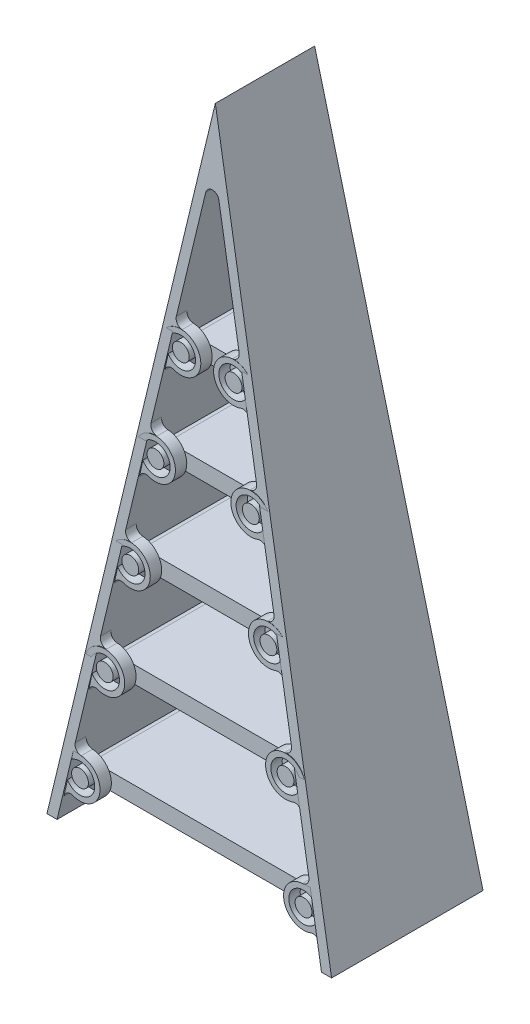
from build123d import *
from build123d.topology import SkipClean

# Parameters (mm, degrees)
AUFSATZ_LINEAR_AUSTRAGEN4_DEPTH      = 18
SCHNITT_LINEAR_AUSTRAGEN1_DEPTH      = 89.73537072
AUFSATZ_LINEAR_AUSTRAGEN5_DEPTH      = 5.37
AUFSATZ_LINEAR_AUSTRAGEN5_DEPTH_BACK = 5.37
AUFSATZ_LINEAR_AUSTRAGEN6_DEPTH      = 5.85
AUFSATZ_LINEAR_AUSTRAGEN6_DEPTH_BACK = 5.85
AUFSATZ_LINEAR_AUSTRAGEN7_DEPTH      = 6.3
AUFSATZ_LINEAR_AUSTRAGEN7_DEPTH_BACK = 6.3
AUFSATZ_LINEAR_AUSTRAGEN8_DEPTH      = 6.8
AUFSATZ_LINEAR_AUSTRAGEN8_DEPTH_BACK = 6.8
AUFSATZ_LINEAR_AUSTRAGEN9_DEPTH      = 7.2
AUFSATZ_LINEAR_AUSTRAGEN9_DEPTH_BACK = 7.2
SKIZZE13_R                           = 1
AUFSATZ_LINEAR_AUSTRAGEN12_DEPTH     = 1.5
SKIZZE14_R                           = 1
AUFSATZ_LINEAR_AUSTRAGEN13_DEPTH     = 1.5
SKIZZE15_R                           = 1
AUFSATZ_LINEAR_AUSTRAGEN14_DEPTH     = 1.5
SKIZZE16_R                           = 1
AUFSATZ_LINEAR_AUSTRAGEN15_DEPTH     = 1.5
SKIZZE17_R                           = 1
AUFSATZ_LINEAR_AUSTRAGEN16_DEPTH     = 1.5
SKIZZE18_R                           = 1
AUFSATZ_LINEAR_AUSTRAGEN17_DEPTH     = 1.5
SKIZZE19_R                           = 1
AUFSATZ_LINEAR_AUSTRAGEN18_DEPTH     = 1.5
SKIZZE20_R                           = 1
AUFSATZ_LINEAR_AUSTRAGEN19_DEPTH     = 1.5
SKIZZE21_R                           = 1
AUFSATZ_LINEAR_AUSTRAGEN20_DEPTH     = 1.5
SKIZZE22_R                           = 1
AUFSATZ_LINEAR_AUSTRAGEN21_DEPTH     = 1.5
SKIZZE24_R                           = 2.375
SKIZZE24_R_2                         = 1.75
AUFSATZ_LINEAR_AUSTRAGEN22_DEPTH     = 1.35
SKIZZE25_R                           = 2.375
SKIZZE25_R_2                         = 1.75
AUFSATZ_LINEAR_AUSTRAGEN23_DEPTH     = 1.35
SKIZZE26_R                           = 2.375
SKIZZE26_R_2                         = 1.75
AUFSATZ_LINEAR_AUSTRAGEN24_DEPTH     = 1.35
SKIZZE27_R                           = 2.375
SKIZZE27_R_2                         = 1.75
AUFSATZ_LINEAR_AUSTRAGEN25_DEPTH     = 1.35
SKIZZE28_R                           = 2.375
SKIZZE28_R_2                         = 1.75
AUFSATZ_LINEAR_AUSTRAGEN26_DEPTH     = 1.35
AUFSATZ_LINEAR_START                 = -1.35
SKIZZE29_R                           = 2.375
SKIZZE29_R_2                         = 1.75
AUFSATZ_LINEAR_AUSTRAGEN27_DEPTH     = 1.35
SKIZZE30_R                           = 2.375
SKIZZE30_R_2                         = 1.75
AUFSATZ_LINEAR_AUSTRAGEN28_DEPTH     = 1.35
SKIZZE31_R                           = 2.375
SKIZZE31_R_2                         = 1.75
AUFSATZ_LINEAR_AUSTRAGEN29_DEPTH     = 1.35
SKIZZE32_R                           = 2.375
SKIZZE32_R_2                         = 1.75
AUFSATZ_LINEAR_AUSTRAGEN30_DEPTH     = 1.35
SKIZZE33_R                           = 2.375
SKIZZE33_R_2                         = 1.75
AUFSATZ_LINEAR_AUSTRAGEN31_DEPTH     = 1.35
VERRUNDUNG1_R                        = 0.8
VERRUNDUNG2_R                        = 0.8


with BuildPart() as part:
    # Skizze1 → Aufsatz-Linear austragen4 (new body)
    with BuildSketch(Plane.XY):
        Polygon((0, 0), (16.911148858, -80), (15.711148858, -80), (0, -5.676728459), (-15.711148858, -80), (-16.911148858, -80), align=None)
    extrude(amount=AUFSATZ_LINEAR_AUSTRAGEN4_DEPTH)

    # Skizze11 → Schnitt-Linear austragen1 (cut, through all)
    with BuildSketch(Plane(origin=(17, 0, 0), x_dir=(0, 0, -1), z_dir=(1, 0, 0))):
        Polygon((-18, -80), (-14.9, 0), (-18, 0), align=None)
        Polygon((0, -80), (-3.1, 0), (0, 0), align=None)
    extrude(amount=-SCHNITT_LINEAR_AUSTRAGEN1_DEPTH, mode=Mode.SUBTRACT)

    # Skizze24 → Aufsatz-Linear austragen22 (add)
    # profile 1 of 2: a face of its own
    with BuildSketch(Plane.XY.offset(15.87)):
        with Locations((-3.132547008, -26.676728459)):
            Circle(SKIZZE24_R)
        with Locations((-3.132547008, -26.676728459)):
            Circle(SKIZZE24_R_2, mode=Mode.SUBTRACT)
    # profile 2 of 2: a face of its own
    with BuildSketch(Plane.XY.offset(15.87)):
        with Locations((3.132547008, -26.676728459)):
            Circle(SKIZZE24_R)
        with Locations((3.132547008, -26.676728459)):
            Circle(SKIZZE24_R_2, mode=Mode.SUBTRACT)
    extrude(amount=-AUFSATZ_LINEAR_AUSTRAGEN22_DEPTH)

    # Skizze25 → Aufsatz-Linear austragen23 (add)
    # profile 1 of 2: a face of its own
    with BuildSketch(Plane.XY.offset(16.35)):
        with Locations((-5.669219336, -38.676728459)):
            Circle(SKIZZE25_R)
        with Locations((-5.669219336, -38.676728459)):
            Circle(SKIZZE25_R_2, mode=Mode.SUBTRACT)
    # profile 2 of 2: a face of its own
    with BuildSketch(Plane.XY.offset(16.35)):
        with Locations((5.669219336, -38.676728459)):
            Circle(SKIZZE25_R)
        with Locations((5.669219336, -38.676728459)):
            Circle(SKIZZE25_R_2, mode=Mode.SUBTRACT)
    extrude(amount=-AUFSATZ_LINEAR_AUSTRAGEN23_DEPTH)

    # Skizze26 → Aufsatz-Linear austragen24 (add)
    # profile 1 of 2: a face of its own
    with BuildSketch(Plane.XY.offset(16.8)):
        with Locations((-8.205891665, -50.676728459)):
            Circle(SKIZZE26_R)
        with Locations((-8.205891665, -50.676728459)):
            Circle(SKIZZE26_R_2, mode=Mode.SUBTRACT)
    # profile 2 of 2: a face of its own
    with BuildSketch(Plane.XY.offset(16.8)):
        with Locations((8.205891665, -50.676728459)):
            Circle(SKIZZE26_R)
        with Locations((8.205891665, -50.676728459)):
            Circle(SKIZZE26_R_2, mode=Mode.SUBTRACT)
    extrude(amount=-AUFSATZ_LINEAR_AUSTRAGEN24_DEPTH)

    # Skizze27 → Aufsatz-Linear austragen25 (add)
    # profile 1 of 2: a face of its own
    with BuildSketch(Plane.XY.offset(17.3)):
        with Locations((-10.742563994, -62.676728459)):
            Circle(SKIZZE27_R)
        with Locations((-10.742563994, -62.676728459)):
            Circle(SKIZZE27_R_2, mode=Mode.SUBTRACT)
    # profile 2 of 2: a face of its own
    with BuildSketch(Plane.XY.offset(17.3)):
        with Locations((10.742563994, -62.676728459)):
            Circle(SKIZZE27_R)
        with Locations((10.742563994, -62.676728459)):
            Circle(SKIZZE27_R_2, mode=Mode.SUBTRACT)
    extrude(amount=-AUFSATZ_LINEAR_AUSTRAGEN25_DEPTH)

    # Skizze28 → Aufsatz-Linear austragen26 (add)
    # profile 1 of 2: a face of its own
    with BuildSketch(Plane.XY.offset(17.7)):
        with Locations((-13.279236322, -74.676728459)):
            Circle(SKIZZE28_R)
        with Locations((-13.279236322, -74.676728459)):
            Circle(SKIZZE28_R_2, mode=Mode.SUBTRACT)
    # profile 2 of 2: a face of its own
    with BuildSketch(Plane.XY.offset(17.7)):
        with Locations((13.279236322, -74.676728459)):
            Circle(SKIZZE28_R)
        with Locations((13.279236322, -74.676728459)):
            Circle(SKIZZE28_R_2, mode=Mode.SUBTRACT)
    extrude(amount=-AUFSATZ_LINEAR_AUSTRAGEN26_DEPTH)

    # Skizze29 → Aufsatz-Linear austragen27 (add)
    # profile 1 of 2: a face of its own
    with BuildSketch(Plane(origin=(0, 0, 2.13), x_dir=(-1, 0, 0), z_dir=(0, 0, -1)).offset(AUFSATZ_LINEAR_START)):
        with Locations((-3.132547008, -26.676728459)):
            Circle(SKIZZE29_R)
        with Locations((-3.132547008, -26.676728459)):
            Circle(SKIZZE29_R_2, mode=Mode.SUBTRACT)
    # profile 2 of 2: a face of its own
    with BuildSketch(Plane(origin=(0, 0, 2.13), x_dir=(-1, 0, 0), z_dir=(0, 0, -1)).offset(AUFSATZ_LINEAR_START)):
        with Locations((3.132547008, -26.676728459)):
            Circle(SKIZZE29_R)
        with Locations((3.132547008, -26.676728459)):
            Circle(SKIZZE29_R_2, mode=Mode.SUBTRACT)
    extrude(amount=AUFSATZ_LINEAR_AUSTRAGEN27_DEPTH)

    # Skizze30 → Aufsatz-Linear austragen28 (add)
    # profile 1 of 2: a face of its own
    with BuildSketch(Plane(origin=(0, 0, 1.65), x_dir=(-1, 0, 0), z_dir=(0, 0, -1)).offset(AUFSATZ_LINEAR_START)):
        with Locations((-5.669219336, -38.676728459)):
            Circle(SKIZZE30_R)
        with Locations((-5.669219336, -38.676728459)):
            Circle(SKIZZE30_R_2, mode=Mode.SUBTRACT)
    # profile 2 of 2: a face of its own
    with BuildSketch(Plane(origin=(0, 0, 1.65), x_dir=(-1, 0, 0), z_dir=(0, 0, -1)).offset(AUFSATZ_LINEAR_START)):
        with Locations((5.669219336, -38.676728459)):
            Circle(SKIZZE30_R)
        with Locations((5.669219336, -38.676728459)):
            Circle(SKIZZE30_R_2, mode=Mode.SUBTRACT)
    extrude(amount=AUFSATZ_LINEAR_AUSTRAGEN28_DEPTH)

    # Skizze31 → Aufsatz-Linear austragen29 (add)
    # profile 1 of 2: a face of its own
    with BuildSketch(Plane(origin=(0, 0, 1.2), x_dir=(-1, 0, 0), z_dir=(0, 0, -1)).offset(AUFSATZ_LINEAR_START)):
        with Locations((-8.205891665, -50.676728459)):
            Circle(SKIZZE31_R)
        with Locations((-8.205891665, -50.676728459)):
            Circle(SKIZZE31_R_2, mode=Mode.SUBTRACT)
    # profile 2 of 2: a face of its own
    with BuildSketch(Plane(origin=(0, 0, 1.2), x_dir=(-1, 0, 0), z_dir=(0, 0, -1)).offset(AUFSATZ_LINEAR_START)):
        with Locations((8.205891665, -50.676728459)):
            Circle(SKIZZE31_R)
        with Locations((8.205891665, -50.676728459)):
            Circle(SKIZZE31_R_2, mode=Mode.SUBTRACT)
    extrude(amount=AUFSATZ_LINEAR_AUSTRAGEN29_DEPTH)

    # Skizze32 → Aufsatz-Linear austragen30 (add)
    # profile 1 of 2: a face of its own
    with BuildSketch(Plane(origin=(0, 0, 0.7), x_dir=(-1, 0, 0), z_dir=(0, 0, -1)).offset(AUFSATZ_LINEAR_START)):
        with Locations((-10.742563994, -62.676728459)):
            Circle(SKIZZE32_R)
        with Locations((-10.742563994, -62.676728459)):
            Circle(SKIZZE32_R_2, mode=Mode.SUBTRACT)
    # profile 2 of 2: a face of its own
    with BuildSketch(Plane(origin=(0, 0, 0.7), x_dir=(-1, 0, 0), z_dir=(0, 0, -1)).offset(AUFSATZ_LINEAR_START)):
        with Locations((10.742563994, -62.676728459)):
            Circle(SKIZZE32_R)
        with Locations((10.742563994, -62.676728459)):
            Circle(SKIZZE32_R_2, mode=Mode.SUBTRACT)
    extrude(amount=AUFSATZ_LINEAR_AUSTRAGEN30_DEPTH)

    # Skizze33 → Aufsatz-Linear austragen31 (add)
    # profile 1 of 2: a face of its own
    with BuildSketch(Plane(origin=(0, 0, 0.3), x_dir=(-1, 0, 0), z_dir=(0, 0, -1)).offset(AUFSATZ_LINEAR_START)):
        with Locations((-13.279236322, -74.676728459)):
            Circle(SKIZZE33_R)
        with Locations((-13.279236322, -74.676728459)):
            Circle(SKIZZE33_R_2, mode=Mode.SUBTRACT)
    # profile 2 of 2: a face of its own
    with BuildSketch(Plane(origin=(0, 0, 0.3), x_dir=(-1, 0, 0), z_dir=(0, 0, -1)).offset(AUFSATZ_LINEAR_START)):
        with Locations((13.279236322, -74.676728459)):
            Circle(SKIZZE33_R)
        with Locations((13.279236322, -74.676728459)):
            Circle(SKIZZE33_R_2, mode=Mode.SUBTRACT)
    extrude(amount=AUFSATZ_LINEAR_AUSTRAGEN31_DEPTH)

    # Verrundung1
    verrundung1_edges = [part.edges().sort_by_distance(p)[0] for p in [
        (0, -5.676728459, 9),
    ]]
    fillet(verrundung1_edges, radius=VERRUNDUNG1_R)

    # Verrundung2
    # the kernel refuses this fillet: 0.8 mm, written as the material it adds along each edge
    with BuildSketch(Plane(origin=(-7.333926251, -40.370651683, 15), x_dir=(-0.20681895998091412, -0.9783792300495822, 0), z_dir=(0, 0, 1)), Plane(origin=(-9.87059858, -52.370651683, 15.45), x_dir=(-0.20681895998091412, -0.9783792300495822, 0), z_dir=(0, 0, 1)), Plane(origin=(-12.407270908, -64.370651683, 15.95), x_dir=(-0.2068189599809156, -0.9783792300495817, 0), z_dir=(0, 0, 1)), Plane(origin=(-14.943943237, -76.370651683, 16.35), x_dir=(-0.2068189599809131, -0.9783792300495824, 0), z_dir=(0, 0, 1)), Plane(origin=(-4.797253922, -28.370651683, 2.13), x_dir=(-0.20681895998091113, -0.9783792300495827, 0), z_dir=(0, 0, 1)), Plane(origin=(-7.333926251, -40.370651683, 1.65), x_dir=(-0.2068189599809139, -0.9783792300495822, 0), z_dir=(0, 0, 1)), Plane(origin=(-9.87059858, -52.370651683, 1.2), x_dir=(-0.20681895998091412, -0.9783792300495822, 0), z_dir=(0, 0, 1)), Plane(origin=(-12.407270908, -64.370651683, 0.7), x_dir=(-0.20681895998091412, -0.9783792300495822, 0), z_dir=(0, 0, 1)), Plane(origin=(-14.943943237, -76.370651683, 0.3), x_dir=(-0.2068189599809131, -0.9783792300495824, 0), z_dir=(0, 0, 1)), Plane(origin=(-4.797253922, -28.370651683, 14.52), x_dir=(-0.20681895998091177, -0.9783792300495826, 0), z_dir=(0, 0, 1))) as verrundung2_piece_1:
        with BuildLine():
            CenterArc((1.137162009, 0.8), VERRUNDUNG2_R, 171.334207831, 98.665792169)
            ThreePointArc((0.346294794, 0.920536499), (0.221320117, 0.44214625), (0, 0))
            Line((0, 0), (1.137162009, 0))
        make_face()
    extrude(amount=1.35)
    with BuildSketch(Plane(origin=(-6.505991795, -36.45401911, 15), x_dir=(0.20681895998091263, 0.9783792300495825, 0), z_dir=(0, 0, 1))) as verrundung2_piece_2_section:
        with BuildLine():
            CenterArc((1.137162009, -0.8), VERRUNDUNG2_R, 90, 98.665792169)
            ThreePointArc((0.346294794, -0.920536499), (0.221320117, -0.44214625), (0, 0))
            Line((0, 0), (1.137162009, 0))
        make_face()
    verrundung2_piece_2 = extrude(amount=4.155498263, mode=Mode.PRIVATE)
    verrundung2_piece_2 = split(verrundung2_piece_2, bisect_by=Plane(origin=(-6.217215771, -36.095589606, 16.298704097), z_dir=(0, -0.03872093994908253, -0.9992500632021294)), keep=Keep.TOP, mode=Mode.PRIVATE)
    add(verrundung2_piece_2)
    with BuildSketch(Plane(origin=(7.333926251, -40.370651683, 15), x_dir=(0.20681895998091462, -0.9783792300495819, 0), z_dir=(0, 0, 1)), Plane(origin=(9.87059858, -52.370651683, 15.45), x_dir=(0.20681895998091263, -0.9783792300495825, 0), z_dir=(0, 0, 1)), Plane(origin=(12.407270908, -64.370651683, 15.95), x_dir=(0.20681895998091412, -0.9783792300495822, 0), z_dir=(0, 0, 1)), Plane(origin=(14.943943237, -76.370651683, 16.35), x_dir=(0.20681895998090907, -0.9783792300495833, 0), z_dir=(0, 0, 1)), Plane(origin=(4.797253922, -28.370651683, 2.13), x_dir=(0.20681895998091462, -0.9783792300495819, 0), z_dir=(0, 0, 1)), Plane(origin=(7.333926251, -40.370651683, 1.65), x_dir=(0.20681895998091462, -0.9783792300495819, 0), z_dir=(0, 0, 1)), Plane(origin=(9.87059858, -52.370651683, 1.2), x_dir=(0.20681895998091412, -0.9783792300495822, 0), z_dir=(0, 0, 1)), Plane(origin=(12.407270908, -64.370651683, 0.7), x_dir=(0.20681895998091412, -0.9783792300495822, 0), z_dir=(0, 0, 1)), Plane(origin=(14.943943237, -76.370651683, 0.3), x_dir=(0.20681895998091113, -0.9783792300495827, 0), z_dir=(0, 0, 1)), Plane(origin=(4.797253922, -28.370651683, 14.52), x_dir=(0.20681895998091462, -0.9783792300495819, 0), z_dir=(0, 0, 1))) as verrundung2_piece_3:
        with BuildLine():
            CenterArc((1.137162009, -0.8), VERRUNDUNG2_R, 90, 98.665792169)
            ThreePointArc((0.346294794, -0.920536499), (0.221320117, -0.44214625), (0, 0))
            Line((0, 0), (1.137162009, 0))
        make_face()
    extrude(amount=1.35)
    with BuildSketch(Plane(origin=(6.505991795, -36.45401911, 15), x_dir=(-0.20681895998091487, 0.9783792300495819, 0), z_dir=(0, 0, 1))) as verrundung2_piece_4_section:
        with BuildLine():
            CenterArc((1.137162009, 0.8), VERRUNDUNG2_R, 171.334207831, 98.665792169)
            ThreePointArc((0.346294794, 0.920536499), (0.221320117, 0.44214625), (0, 0))
            Line((0, 0), (1.137162009, 0))
        make_face()
    verrundung2_piece_4 = extrude(amount=4.155498263, mode=Mode.PRIVATE)
    verrundung2_piece_4 = split(verrundung2_piece_4, bisect_by=Plane(origin=(6.217215771, -36.095589606, 16.298704097), z_dir=(0, -0.03872093994908253, -0.9992500632021294)), keep=Keep.TOP, mode=Mode.PRIVATE)
    add(verrundung2_piece_4)
    with BuildSketch(Plane(origin=(-9.042664124, -48.45401911, 15.45), x_dir=(0.20681895998091288, 0.9783792300495825, 0), z_dir=(0, 0, 1))) as verrundung2_piece_5_section:
        with BuildLine():
            CenterArc((1.137162009, -0.8), VERRUNDUNG2_R, 90, 98.665792169)
            ThreePointArc((0.346294794, -0.920536499), (0.221320117, -0.44214625), (0, 0))
            Line((0, 0), (1.137162009, 0))
        make_face()
    verrundung2_piece_5 = extrude(amount=4.170498263, mode=Mode.PRIVATE)
    verrundung2_piece_5 = split(verrundung2_piece_5, bisect_by=Plane(origin=(-8.753891259, -48.095283689, 16.763692243), z_dir=(0, -0.03872093994908253, -0.9992500632021294)), keep=Keep.TOP, mode=Mode.PRIVATE)
    add(verrundung2_piece_5)
    with BuildSketch(Plane(origin=(9.042664124, -48.45401911, 15.45), x_dir=(-0.2068189599809156, 0.9783792300495817, 0), z_dir=(0, 0, 1))) as verrundung2_piece_6_section:
        with BuildLine():
            CenterArc((1.137162009, 0.8), VERRUNDUNG2_R, 171.334207831, 98.665792169)
            ThreePointArc((0.346294794, 0.920536499), (0.221320117, 0.44214625), (0, 0))
            Line((0, 0), (1.137162009, 0))
        make_face()
    verrundung2_piece_6 = extrude(amount=4.170498263, mode=Mode.PRIVATE)
    verrundung2_piece_6 = split(verrundung2_piece_6, bisect_by=Plane(origin=(8.753891259, -48.095283689, 16.763692243), z_dir=(0, -0.03872093994908253, -0.9992500632021294)), keep=Keep.TOP, mode=Mode.PRIVATE)
    add(verrundung2_piece_6)
    with BuildSketch(Plane(origin=(-11.579336453, -60.45401911, 15.95), x_dir=(0.2068189599809101, 0.9783792300495829, 0), z_dir=(0, 0, 1))) as verrundung2_piece_7_section:
        with BuildLine():
            CenterArc((1.137162009, -0.8), VERRUNDUNG2_R, 90, 98.665792169)
            ThreePointArc((0.346294794, -0.920536499), (0.221320117, -0.44214625), (0, 0))
            Line((0, 0), (1.137162009, 0))
        make_face()
    verrundung2_piece_7 = extrude(amount=4.135498263, mode=Mode.PRIVATE)
    verrundung2_piece_7 = split(verrundung2_piece_7, bisect_by=Plane(origin=(-11.290556099, -60.095998069, 17.228719925), z_dir=(0, -0.03872093994908253, -0.9992500632021294)), keep=Keep.TOP, mode=Mode.PRIVATE)
    add(verrundung2_piece_7)
    with BuildSketch(Plane(origin=(11.579336453, -60.45401911, 15.95), x_dir=(-0.20681895998091435, 0.978379230049582, 0), z_dir=(0, 0, 1))) as verrundung2_piece_8_section:
        with BuildLine():
            CenterArc((1.137162009, 0.8), VERRUNDUNG2_R, 171.334207831, 98.665792169)
            ThreePointArc((0.346294794, 0.920536499), (0.221320117, 0.44214625), (0, 0))
            Line((0, 0), (1.137162009, 0))
        make_face()
    verrundung2_piece_8 = extrude(amount=4.135498263, mode=Mode.PRIVATE)
    verrundung2_piece_8 = split(verrundung2_piece_8, bisect_by=Plane(origin=(11.290556099, -60.095998069, 17.228719925), z_dir=(0, -0.03872093994908253, -0.9992500632021294)), keep=Keep.TOP, mode=Mode.PRIVATE)
    add(verrundung2_piece_8)
    with BuildSketch(Plane(origin=(-14.116008781, -72.45401911, 16.35), x_dir=(0.20681895998091412, 0.9783792300495822, 0), z_dir=(0, 0, 1))) as verrundung2_piece_9_section:
        with BuildLine():
            CenterArc((1.137162009, -0.8), VERRUNDUNG2_R, 90, 98.665792169)
            ThreePointArc((0.346294794, -0.920536499), (0.221320117, -0.44214625), (0, 0))
            Line((0, 0), (1.137162009, 0))
        make_face()
    verrundung2_piece_9 = extrude(amount=1.35, mode=Mode.PRIVATE)
    verrundung2_piece_9 = split(verrundung2_piece_9, bisect_by=Plane(origin=(-13.827218085, -72.094512866, 17.693662374), z_dir=(0, -0.03872093994908253, -0.9992500632021294)), keep=Keep.TOP, mode=Mode.PRIVATE)
    add(verrundung2_piece_9)
    with BuildSketch(Plane(origin=(14.116008781, -72.45401911, 16.35), x_dir=(-0.20681895998091662, 0.9783792300495815, 0), z_dir=(0, 0, 1))) as verrundung2_piece_10_section:
        with BuildLine():
            CenterArc((1.137162009, 0.8), VERRUNDUNG2_R, 171.334207831, 98.665792169)
            ThreePointArc((0.346294794, 0.920536499), (0.221320117, 0.44214625), (0, 0))
            Line((0, 0), (1.137162009, 0))
        make_face()
    verrundung2_piece_10 = extrude(amount=1.35, mode=Mode.PRIVATE)
    verrundung2_piece_10 = split(verrundung2_piece_10, bisect_by=Plane(origin=(13.827218085, -72.094512866, 17.693662374), z_dir=(0, -0.03872093994908253, -0.9992500632021294)), keep=Keep.TOP, mode=Mode.PRIVATE)
    add(verrundung2_piece_10)
    with BuildSketch(Plane(origin=(3.969319467, -24.45401911, -0.690498263), x_dir=(-0.20681895998091412, 0.9783792300495822, 0), z_dir=(0, 0, 1))) as verrundung2_piece_11_section:
        with BuildLine():
            CenterArc((1.137162009, 0.8), VERRUNDUNG2_R, 171.334207831, 98.665792169)
            ThreePointArc((0.346294794, 0.920536499), (0.221320117, 0.44214625), (0, 0))
            Line((0, 0), (1.137162009, 0))
        make_face()
    verrundung2_piece_11 = extrude(amount=4.170498263, mode=Mode.PRIVATE)
    verrundung2_piece_11 = split(verrundung2_piece_11, bisect_by=Plane(origin=(3.680546602, -24.095283689, 2.166307757), z_dir=(0, -0.03872093994908251, 0.9992500632021294)), keep=Keep.TOP, mode=Mode.PRIVATE)
    add(verrundung2_piece_11)
    with BuildSketch(Plane(origin=(-3.969319467, -24.45401911, -0.690498263), x_dir=(0.20681895998091285, 0.9783792300495823, 0), z_dir=(0, 0, 1))) as verrundung2_piece_12_section:
        with BuildLine():
            CenterArc((1.137162009, -0.8), VERRUNDUNG2_R, 90, 98.665792169)
            ThreePointArc((0.346294794, -0.920536499), (0.221320117, -0.44214625), (0, 0))
            Line((0, 0), (1.137162009, 0))
        make_face()
    verrundung2_piece_12 = extrude(amount=4.170498263, mode=Mode.PRIVATE)
    verrundung2_piece_12 = split(verrundung2_piece_12, bisect_by=Plane(origin=(-3.680546602, -24.095283689, 2.166307757), z_dir=(0, -0.03872093994908251, 0.9992500632021294)), keep=Keep.TOP, mode=Mode.PRIVATE)
    add(verrundung2_piece_12)
    with BuildSketch(Plane(origin=(6.505991795, -36.45401911, -1.155498263), x_dir=(-0.20681895998091537, 0.9783792300495818, 0), z_dir=(0, 0, 1))) as verrundung2_piece_13_section:
        with BuildLine():
            CenterArc((1.137162009, 0.8), VERRUNDUNG2_R, 171.334207831, 98.665792169)
            ThreePointArc((0.346294794, 0.920536499), (0.221320117, 0.44214625), (0, 0))
            Line((0, 0), (1.137162009, 0))
        make_face()
    verrundung2_piece_13 = extrude(amount=4.155498263, mode=Mode.PRIVATE)
    verrundung2_piece_13 = split(verrundung2_piece_13, bisect_by=Plane(origin=(6.217215771, -36.095589606, 1.701295903), z_dir=(0, -0.03872093994908251, 0.9992500632021294)), keep=Keep.TOP, mode=Mode.PRIVATE)
    add(verrundung2_piece_13)
    with BuildSketch(Plane(origin=(-6.505991795, -36.45401911, -1.155498263), x_dir=(0.20681895998091288, 0.9783792300495825, 0), z_dir=(0, 0, 1))) as verrundung2_piece_14_section:
        with BuildLine():
            CenterArc((1.137162009, -0.8), VERRUNDUNG2_R, 90, 98.665792169)
            ThreePointArc((0.346294794, -0.920536499), (0.221320117, -0.44214625), (0, 0))
            Line((0, 0), (1.137162009, 0))
        make_face()
    verrundung2_piece_14 = extrude(amount=4.155498263, mode=Mode.PRIVATE)
    verrundung2_piece_14 = split(verrundung2_piece_14, bisect_by=Plane(origin=(-6.217215771, -36.095589606, 1.701295903), z_dir=(0, -0.03872093994908251, 0.9992500632021294)), keep=Keep.TOP, mode=Mode.PRIVATE)
    add(verrundung2_piece_14)
    with BuildSketch(Plane(origin=(9.042664124, -48.45401911, -1.620498263), x_dir=(-0.20681895998091412, 0.9783792300495822, 0), z_dir=(0, 0, 1))) as verrundung2_piece_15_section:
        with BuildLine():
            CenterArc((1.137162009, 0.8), VERRUNDUNG2_R, 171.334207831, 98.665792169)
            ThreePointArc((0.346294794, 0.920536499), (0.221320117, 0.44214625), (0, 0))
            Line((0, 0), (1.137162009, 0))
        make_face()
    verrundung2_piece_15 = extrude(amount=4.170498263, mode=Mode.PRIVATE)
    verrundung2_piece_15 = split(verrundung2_piece_15, bisect_by=Plane(origin=(8.753891259, -48.095283689, 1.236307757), z_dir=(0, -0.03872093994908251, 0.9992500632021294)), keep=Keep.TOP, mode=Mode.PRIVATE)
    add(verrundung2_piece_15)
    with BuildSketch(Plane(origin=(-9.042664124, -48.45401911, -1.620498263), x_dir=(0.20681895998091263, 0.9783792300495825, 0), z_dir=(0, 0, 1))) as verrundung2_piece_16_section:
        with BuildLine():
            CenterArc((1.137162009, -0.8), VERRUNDUNG2_R, 90, 98.665792169)
            ThreePointArc((0.346294794, -0.920536499), (0.221320117, -0.44214625), (0, 0))
            Line((0, 0), (1.137162009, 0))
        make_face()
    verrundung2_piece_16 = extrude(amount=4.170498263, mode=Mode.PRIVATE)
    verrundung2_piece_16 = split(verrundung2_piece_16, bisect_by=Plane(origin=(-8.753891259, -48.095283689, 1.236307757), z_dir=(0, -0.03872093994908251, 0.9992500632021294)), keep=Keep.TOP, mode=Mode.PRIVATE)
    add(verrundung2_piece_16)
    with BuildSketch(Plane(origin=(11.579336453, -60.45401911, -2.085498263), x_dir=(-0.20681895998091412, 0.9783792300495822, 0), z_dir=(0, 0, 1))) as verrundung2_piece_17_section:
        with BuildLine():
            CenterArc((1.137162009, 0.8), VERRUNDUNG2_R, 171.334207831, 98.665792169)
            ThreePointArc((0.346294794, 0.920536499), (0.221320117, 0.44214625), (0, 0))
            Line((0, 0), (1.137162009, 0))
        make_face()
    verrundung2_piece_17 = extrude(amount=4.135498263, mode=Mode.PRIVATE)
    verrundung2_piece_17 = split(verrundung2_piece_17, bisect_by=Plane(origin=(11.290556099, -60.095998069, 0.771280075), z_dir=(0, -0.03872093994908251, 0.9992500632021294)), keep=Keep.TOP, mode=Mode.PRIVATE)
    add(verrundung2_piece_17)
    with BuildSketch(Plane(origin=(-11.579336453, -60.45401911, -2.085498263), x_dir=(0.2068189599809131, 0.9783792300495824, 0), z_dir=(0, 0, 1))) as verrundung2_piece_18_section:
        with BuildLine():
            CenterArc((1.137162009, -0.8), VERRUNDUNG2_R, 90, 98.665792169)
            ThreePointArc((0.346294794, -0.920536499), (0.221320117, -0.44214625), (0, 0))
            Line((0, 0), (1.137162009, 0))
        make_face()
    verrundung2_piece_18 = extrude(amount=4.135498263, mode=Mode.PRIVATE)
    verrundung2_piece_18 = split(verrundung2_piece_18, bisect_by=Plane(origin=(-11.290556099, -60.095998069, 0.771280075), z_dir=(0, -0.03872093994908251, 0.9992500632021294)), keep=Keep.TOP, mode=Mode.PRIVATE)
    add(verrundung2_piece_18)
    with BuildSketch(Plane(origin=(14.116008781, -72.45401911, 0.3), x_dir=(-0.2068189599809156, 0.9783792300495817, 0), z_dir=(0, 0, 1))) as verrundung2_piece_19_section:
        with BuildLine():
            CenterArc((1.137162009, 0.8), VERRUNDUNG2_R, 171.334207831, 98.665792169)
            ThreePointArc((0.346294794, 0.920536499), (0.221320117, 0.44214625), (0, 0))
            Line((0, 0), (1.137162009, 0))
        make_face()
    verrundung2_piece_19 = extrude(amount=1.35, mode=Mode.PRIVATE)
    verrundung2_piece_19 = split(verrundung2_piece_19, bisect_by=Plane(origin=(13.827218085, -72.094512866, 0.306337626), z_dir=(0, -0.03872093994908251, 0.9992500632021294)), keep=Keep.TOP, mode=Mode.PRIVATE)
    add(verrundung2_piece_19)
    with BuildSketch(Plane(origin=(-14.116008781, -72.45401911, 0.3), x_dir=(0.20681895998091412, 0.9783792300495822, 0), z_dir=(0, 0, 1))) as verrundung2_piece_20_section:
        with BuildLine():
            CenterArc((1.137162009, -0.8), VERRUNDUNG2_R, 90, 98.665792169)
            ThreePointArc((0.346294794, -0.920536499), (0.221320117, -0.44214625), (0, 0))
            Line((0, 0), (1.137162009, 0))
        make_face()
    verrundung2_piece_20 = extrude(amount=1.35, mode=Mode.PRIVATE)
    verrundung2_piece_20 = split(verrundung2_piece_20, bisect_by=Plane(origin=(-13.827218085, -72.094512866, 0.306337626), z_dir=(0, -0.03872093994908251, 0.9992500632021294)), keep=Keep.TOP, mode=Mode.PRIVATE)
    add(verrundung2_piece_20)
    with BuildSketch(Plane(origin=(-3.969319467, -24.45401911, 14.52), x_dir=(0.20681895998091399, 0.978379230049582, 0), z_dir=(0, 0, 1))) as verrundung2_piece_21_section:
        with BuildLine():
            CenterArc((1.137162009, -0.8), VERRUNDUNG2_R, 90, 98.665792169)
            ThreePointArc((0.346294794, -0.920536499), (0.221320117, -0.44214625), (0, 0))
            Line((0, 0), (1.137162009, 0))
        make_face()
    verrundung2_piece_21 = extrude(amount=4.170498263, mode=Mode.PRIVATE)
    verrundung2_piece_21 = split(verrundung2_piece_21, bisect_by=Plane(origin=(-3.680546602, -24.095283689, 15.833692243), z_dir=(0, -0.03872093994908253, -0.9992500632021294)), keep=Keep.TOP, mode=Mode.PRIVATE)
    add(verrundung2_piece_21)
    with BuildSketch(Plane(origin=(3.969319467, -24.45401911, 14.52), x_dir=(-0.20681895998091487, 0.9783792300495819, 0), z_dir=(0, 0, 1))) as verrundung2_piece_22_section:
        with BuildLine():
            CenterArc((1.137162009, 0.8), VERRUNDUNG2_R, 171.334207831, 98.665792169)
            ThreePointArc((0.346294794, 0.920536499), (0.221320117, 0.44214625), (0, 0))
            Line((0, 0), (1.137162009, 0))
        make_face()
    verrundung2_piece_22 = extrude(amount=4.170498263, mode=Mode.PRIVATE)
    verrundung2_piece_22 = split(verrundung2_piece_22, bisect_by=Plane(origin=(3.680546602, -24.095283689, 15.833692243), z_dir=(0, -0.03872093994908253, -0.9992500632021294)), keep=Keep.TOP, mode=Mode.PRIVATE)
    add(verrundung2_piece_22)


with BuildPart() as body_2:
    # Skizze6 → Aufsatz-Linear austragen5 (new, two sides: drawn at the far end of the back side and taken through both)
    with BuildSketch(Plane.XY.offset(9).offset(-AUFSATZ_LINEAR_AUSTRAGEN5_DEPTH_BACK)):
        with BuildLine():
            Line((3.132547008, -25.676728459), (-3.132547008, -25.676728459))
            ThreePointArc((-3.132547008, -25.676728459), (-4.132547008, -26.676728459), (-3.132547008, -27.676728459))
            Line((-3.132547008, -27.676728459), (3.132547008, -27.676728459))
            ThreePointArc((3.132547008, -27.676728459), (4.132547008, -26.676728459), (3.132547008, -25.676728459))
        make_face()
    extrude(amount=AUFSATZ_LINEAR_AUSTRAGEN5_DEPTH + AUFSATZ_LINEAR_AUSTRAGEN5_DEPTH_BACK)

    # Skizze13 → Aufsatz-Linear austragen12 (add)
    with BuildSketch(Plane.XY.offset(14.37)):
        with Locations((-3.132547008, -26.676728459)):
            Circle(SKIZZE13_R)
        with Locations((3.132547008, -26.676728459)):
            Circle(SKIZZE13_R)
    extrude(amount=AUFSATZ_LINEAR_AUSTRAGEN12_DEPTH)

    # Skizze18 → Aufsatz-Linear austragen17 (add)
    with SkipClean():  # the faces are left unmerged after this step: merging them gives an invalid solid
        with BuildSketch(Plane(origin=(0, 0, 3.63), x_dir=(-1, 0, 0), z_dir=(0, 0, -1))):
            with Locations(Location((-3.132547008, -26.676728459, 0), (0, 0, 180))):
                Circle(SKIZZE18_R)
            with Locations(Location((3.132547008, -26.676728459, 0), (0, 0, 180))):
                Circle(SKIZZE18_R)
        extrude(amount=AUFSATZ_LINEAR_AUSTRAGEN17_DEPTH)


with BuildPart() as body_3:
    # Skizze7 → Aufsatz-Linear austragen6 (new, two sides: drawn at the far end of the back side and taken through both)
    with BuildSketch(Plane.XY.offset(9).offset(-AUFSATZ_LINEAR_AUSTRAGEN6_DEPTH_BACK)):
        with BuildLine():
            Line((5.669219336, -37.676728459), (-5.669219336, -37.676728459))
            ThreePointArc((-5.669219336, -37.676728459), (-6.669219336, -38.676728459), (-5.669219336, -39.676728459))
            Line((-5.669219336, -39.676728459), (5.669219336, -39.676728459))
            ThreePointArc((5.669219336, -39.676728459), (6.669219336, -38.676728459), (5.669219336, -37.676728459))
        make_face()
    extrude(amount=AUFSATZ_LINEAR_AUSTRAGEN6_DEPTH + AUFSATZ_LINEAR_AUSTRAGEN6_DEPTH_BACK)

    # Skizze14 → Aufsatz-Linear austragen13 (add)
    with BuildSketch(Plane.XY.offset(14.85)):
        with Locations((-5.669219336, -38.676728459)):
            Circle(SKIZZE14_R)
        with Locations((5.669219336, -38.676728459)):
            Circle(SKIZZE14_R)
    extrude(amount=AUFSATZ_LINEAR_AUSTRAGEN13_DEPTH)

    # Skizze19 → Aufsatz-Linear austragen18 (add)
    with SkipClean():  # the faces are left unmerged after this step: merging them gives an invalid solid
        with BuildSketch(Plane(origin=(0, 0, 3.15), x_dir=(-1, 0, 0), z_dir=(0, 0, -1))):
            with Locations(Location((-5.669219336, -38.676728459, 0), (0, 0, 180))):
                Circle(SKIZZE19_R)
            with Locations(Location((5.669219336, -38.676728459, 0), (0, 0, 180))):
                Circle(SKIZZE19_R)
        extrude(amount=AUFSATZ_LINEAR_AUSTRAGEN18_DEPTH)


with BuildPart() as body_4:
    # Skizze8 → Aufsatz-Linear austragen7 (new, two sides: drawn at the far end of the back side and taken through both)
    with BuildSketch(Plane.XY.offset(9).offset(-AUFSATZ_LINEAR_AUSTRAGEN7_DEPTH_BACK)):
        with BuildLine():
            Line((8.205891665, -49.676728459), (-8.205891665, -49.676728459))
            ThreePointArc((-8.205891665, -49.676728459), (-9.205891665, -50.676728459), (-8.205891665, -51.676728459))
            Line((-8.205891665, -51.676728459), (8.205891665, -51.676728459))
            ThreePointArc((8.205891665, -51.676728459), (9.205891665, -50.676728459), (8.205891665, -49.676728459))
        make_face()
    extrude(amount=AUFSATZ_LINEAR_AUSTRAGEN7_DEPTH + AUFSATZ_LINEAR_AUSTRAGEN7_DEPTH_BACK)

    # Skizze15 → Aufsatz-Linear austragen14 (add)
    with BuildSketch(Plane.XY.offset(15.3)):
        with Locations((-8.205891665, -50.676728459)):
            Circle(SKIZZE15_R)
        with Locations((8.205891665, -50.676728459)):
            Circle(SKIZZE15_R)
    extrude(amount=AUFSATZ_LINEAR_AUSTRAGEN14_DEPTH)

    # Skizze20 → Aufsatz-Linear austragen19 (add)
    with BuildSketch(Plane(origin=(0, 0, 2.7), x_dir=(-1, 0, 0), z_dir=(0, 0, -1))):
        with Locations(Location((-8.205891665, -50.676728459, 0), (0, 0, 180))):
            Circle(SKIZZE20_R)
        with Locations(Location((8.205891665, -50.676728459, 0), (0, 0, 180))):
            Circle(SKIZZE20_R)
    extrude(amount=AUFSATZ_LINEAR_AUSTRAGEN19_DEPTH)


with BuildPart() as body_5:
    # Skizze9 → Aufsatz-Linear austragen8 (new, two sides: drawn at the far end of the back side and taken through both)
    with BuildSketch(Plane.XY.offset(9).offset(-AUFSATZ_LINEAR_AUSTRAGEN8_DEPTH_BACK)):
        with BuildLine():
            Line((10.742563994, -61.676728459), (-10.742563994, -61.676728459))
            ThreePointArc((-10.742563994, -61.676728459), (-11.742563994, -62.676728459), (-10.742563994, -63.676728459))
            Line((-10.742563994, -63.676728459), (10.742563994, -63.676728459))
            ThreePointArc((10.742563994, -63.676728459), (11.742563994, -62.676728459), (10.742563994, -61.676728459))
        make_face()
    extrude(amount=AUFSATZ_LINEAR_AUSTRAGEN8_DEPTH + AUFSATZ_LINEAR_AUSTRAGEN8_DEPTH_BACK)

    # Skizze16 → Aufsatz-Linear austragen15 (add)
    with BuildSketch(Plane.XY.offset(15.8)):
        with Locations((-10.742563994, -62.676728459)):
            Circle(SKIZZE16_R)
        with Locations((10.742563994, -62.676728459)):
            Circle(SKIZZE16_R)
    extrude(amount=AUFSATZ_LINEAR_AUSTRAGEN15_DEPTH)

    # Skizze21 → Aufsatz-Linear austragen20 (add)
    with BuildSketch(Plane(origin=(0, 0, 2.2), x_dir=(-1, 0, 0), z_dir=(0, 0, -1))):
        with Locations(Location((-10.742563994, -62.676728459, 0), (0, 0, 180))):
            Circle(SKIZZE21_R)
        with Locations(Location((10.742563994, -62.676728459, 0), (0, 0, 180))):
            Circle(SKIZZE21_R)
    extrude(amount=AUFSATZ_LINEAR_AUSTRAGEN20_DEPTH)


with BuildPart() as body_6:
    # Skizze10 → Aufsatz-Linear austragen9 (new, two sides: drawn at the far end of the back side and taken through both)
    with BuildSketch(Plane.XY.offset(9).offset(-AUFSATZ_LINEAR_AUSTRAGEN9_DEPTH_BACK)):
        with BuildLine():
            Line((13.279236322, -73.676728459), (-13.279236322, -73.676728459))
            ThreePointArc((-13.279236322, -73.676728459), (-14.279236322, -74.676728459), (-13.279236322, -75.676728459))
            Line((-13.279236322, -75.676728459), (13.279236322, -75.676728459))
            ThreePointArc((13.279236322, -75.676728459), (14.279236322, -74.676728459), (13.279236322, -73.676728459))
        make_face()
    extrude(amount=AUFSATZ_LINEAR_AUSTRAGEN9_DEPTH + AUFSATZ_LINEAR_AUSTRAGEN9_DEPTH_BACK)

    # Skizze17 → Aufsatz-Linear austragen16 (add)
    with BuildSketch(Plane.XY.offset(16.2)):
        with Locations((-13.279236322, -74.676728459)):
            Circle(SKIZZE17_R)
        with Locations((13.279236322, -74.676728459)):
            Circle(SKIZZE17_R)
    extrude(amount=AUFSATZ_LINEAR_AUSTRAGEN16_DEPTH)

    # Skizze22 → Aufsatz-Linear austragen21 (add)
    with SkipClean():  # the faces are left unmerged after this step: merging them gives an invalid solid
        with BuildSketch(Plane(origin=(0, 0, 1.8), x_dir=(-1, 0, 0), z_dir=(0, 0, -1))):
            with Locations(Location((-13.279236322, -74.676728459, 0), (0, 0, 180))):
                Circle(SKIZZE22_R)
            with Locations(Location((13.279236322, -74.676728459, 0), (0, 0, 180))):
                Circle(SKIZZE22_R)
        extrude(amount=AUFSATZ_LINEAR_AUSTRAGEN21_DEPTH)


solid = Compound([part.part, body_2.part, body_3.part, body_4.part, body_5.part, body_6.part])
